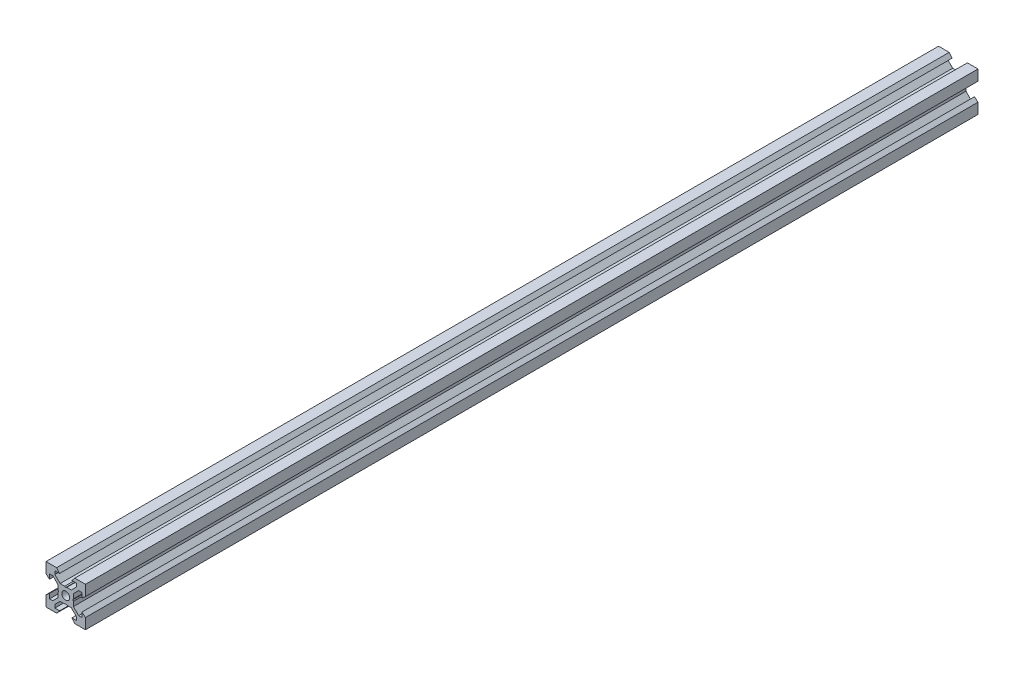
from build123d import *

# Parameters (mm, degrees)
SKETCH1_R           = 2
BOSS_EXTRUDE1_DEPTH = 226.345


with BuildPart() as part:
    # Sketch1 → Boss-Extrude1 (new, symmetric)
    with BuildSketch(Plane.XY):
        Polygon((10, 4.610379336), (10, 10), (4.610379336, 10), (3.1, 8.2), (5.5, 8.2), (5.5, 6.560660172), (2.839339828, 3.9), (0.519615242, 3.9), (0, 3.6), (-0.519615242, 3.9), (-2.839339828, 3.9), (-5.5, 6.560660172), (-5.5, 8.2), (-3.1, 8.2), (-4.610379336, 10), (-10, 10), (-10, 4.610379336), (-8.2, 3.1), (-8.2, 5.5), (-6.560660172, 5.5), (-3.9, 2.839339828), (-3.9, 0.519615242), (-3.6, 0), (-3.9, -0.519615242), (-3.9, -2.839339828), (-6.560660172, -5.5), (-8.2, -5.5), (-8.2, -3.1), (-10, -4.610379336), (-10, -10), (-4.610379336, -10), (-3.1, -8.2), (-5.5, -8.2), (-5.5, -6.560660172), (-2.839339828, -3.9), (-0.519615242, -3.9), (0, -3.6), (0.519615242, -3.9), (2.839339828, -3.9), (5.5, -6.560660172), (5.5, -8.2), (3.1, -8.2), (4.610379336, -10), (10, -10), (10, -4.610379336), (8.2, -3.1), (8.2, -5.5), (6.560660172, -5.5), (3.9, -2.839339828), (3.9, -0.519615242), (3.6, 0), (3.9, 0.519615242), (3.9, 2.839339828), (6.560660172, 5.5), (8.2, 5.5), (8.2, 3.1), align=None)
        Circle(SKETCH1_R, mode=Mode.SUBTRACT)
    extrude(amount=BOSS_EXTRUDE1_DEPTH, both=True)


solid = part.part
